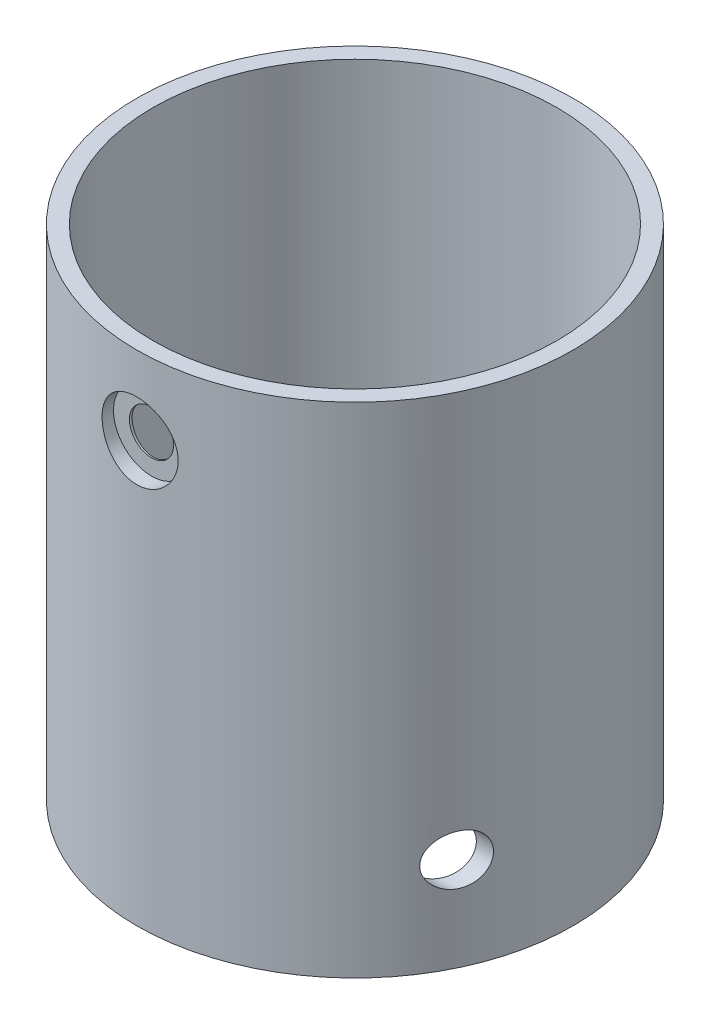
from build123d import *

# Parameters (mm, degrees)
SKETCH1_R           = 22.225
SKETCH1_R_2         = 20.574
BOSS_EXTRUDE1_DEPTH = 50.8
SKETCH2_R           = 2.54
CUT_EXTRUDE1_DEPTH  = 50.8
SKETCH3_R           = 3.875
SKETCH3_R_2         = 2.25
CUT_EXTRUDE2_DEPTH  = 1.5
SKETCH3_2_R         = 2.25
CUT_EXTRUDE3_DEPTH  = 16.17


with BuildPart() as part:
    # Sketch1 → Boss-Extrude1 (new body)
    with BuildSketch(Plane(origin=(0, 0, 0), x_dir=(-1, 0, 0), z_dir=(0, 1, 0))):
        Circle(SKETCH1_R)
        Circle(SKETCH1_R_2, mode=Mode.SUBTRACT)
    extrude(amount=BOSS_EXTRUDE1_DEPTH)

    # Sketch2 → Cut-Extrude1 (cut)
    with BuildSketch(Plane.YZ):
        with Locations((9.525, 9.525)):
            Circle(SKETCH2_R)
    extrude(amount=CUT_EXTRUDE1_DEPTH, mode=Mode.SUBTRACT)

    # Sketch3 → Cut-Extrude2 (cut)
    with BuildSketch(Plane.XY.offset(22.225)):
        with Locations((0, 42.8)):
            Circle(SKETCH3_R)
        with Locations((0, 42.8)):
            Circle(SKETCH3_R_2, mode=Mode.SUBTRACT)
    extrude(amount=-CUT_EXTRUDE2_DEPTH, mode=Mode.SUBTRACT)

    # Sketch3<2> → Cut-Extrude3 (cut)
    with BuildSketch(Plane.XY.offset(22.225)):
        with Locations((0, 42.8)):
            Circle(SKETCH3_2_R)
    extrude(amount=-CUT_EXTRUDE3_DEPTH, mode=Mode.SUBTRACT)


solid = part.part
